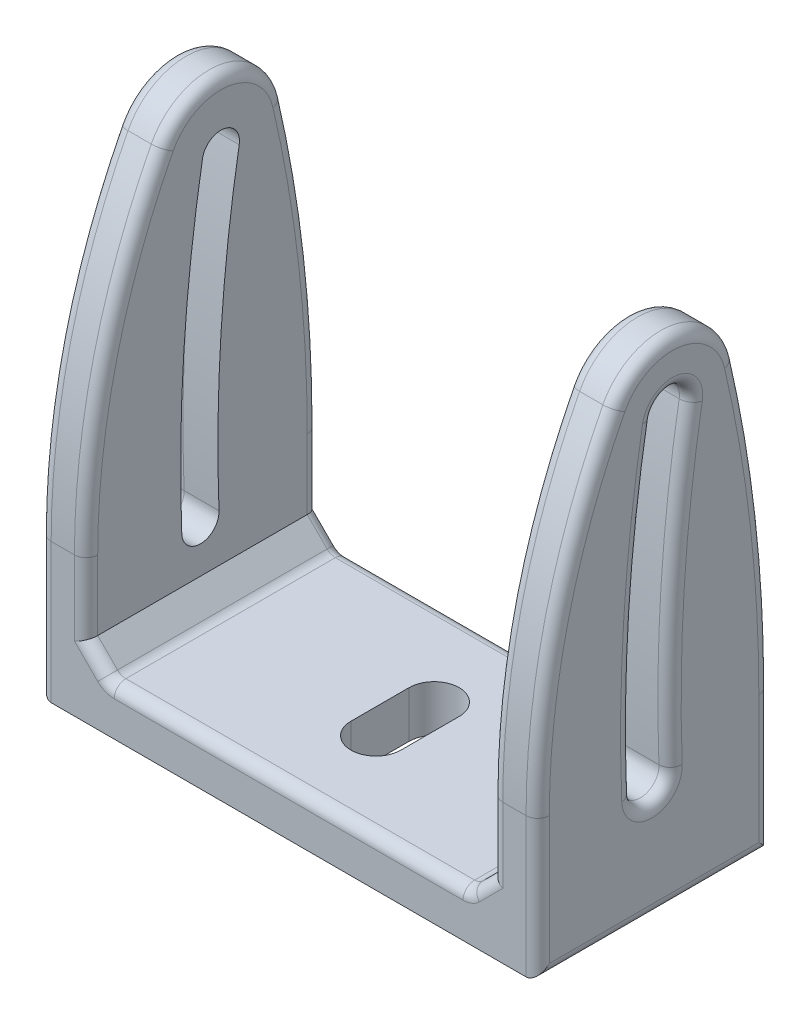
from build123d import *

# Parameters (mm, degrees)
BOSS_EXTRUDE1_DEPTH = 42.8
SKETCH2_W           = 34.8
SKETCH2_H           = 38.311897311
CUT_EXTRUDE1_DEPTH  = 60.585181768
CHAMFER1_SIZE       = 2
FILLET1_R           = 1
CUT_EXTRUDE2_DEPTH  = 59.306444702


with BuildPart() as part:
    # Sketch1 → Boss-Extrude1 (new body)
    with BuildSketch(Plane(origin=(0, 0, 0), x_dir=(0, 0, -1), z_dir=(1, 0, 0))):
        with BuildLine():
            Line((-10, -6), (10, -6))
            Line((10, -6), (10, 6))
            ThreePointArc((10, 6), (9.25619767, 19.071476996), (7.034393072, 31.974202951))
            ThreePointArc((7.034393072, 31.974202951), (2.269388413, 36.269117533), (-3.402199146, 33.271676085))
            ThreePointArc((-3.402199146, 33.271676085), (-8.327095908, 20.029213205), (-10, 6))
            Line((-10, 6), (-10, -6))
        make_face()
        with BuildLine():
            ThreePointArc((0.001705571, 30.983312005), (-1.596543983, 17.513106187), (-1.778018244, 3.949628997))
            ThreePointArc((-1.778018244, 3.949628997), (-0.116879823, 2.413198345), (1.419550828, 4.074336766))
            ThreePointArc((1.419550828, 4.074336766), (1.596543983, 17.302893813), (3.15532829, 30.440482617))
            ThreePointArc((3.15532829, 30.440482617), (1.849931624, 32.288708671), (0.001705571, 30.983312005))
        make_face(mode=Mode.SUBTRACT)
    extrude(amount=BOSS_EXTRUDE1_DEPTH)

    # Sketch2 → Cut-Extrude1 (cut, through all)
    with BuildSketch(Plane.XY.offset(10)):
        with Locations((21.4, 17.155948656)):
            Rectangle(SKETCH2_W, SKETCH2_H)
    extrude(amount=-CUT_EXTRUDE1_DEPTH, mode=Mode.SUBTRACT)

    # Chamfer1
    chamfer1_edges = [part.edges().sort_by_distance(p)[0] for p in [
        (38.8, -2, 0),
        (4, -2, 0),
    ]]
    chamfer(chamfer1_edges, length=CHAMFER1_SIZE)

    # Fillet1
    fillet1_edges = [part.edges().sort_by_distance(p)[0] for p in [
        (38.8, 3, -10),
        (38.8, 3, 10),
        (4, 3, -10),
        (4, 3, 10),
        (38.8, 36.269117533, -2.269388413),
        (4, 36.269117533, -2.269388413),
        (5, -1, -10),
        (5, -1, 10),
        (37.8, -1, -10),
        (37.8, -1, 10),
        (6, -2, 0),
        (21.4, -2, -10),
        (36.8, -2, 0),
        (21.4, -2, 10),
        (42.8, 36.269117533, -2.269388413),
        (0, 36.269117533, -2.269388413),
        (38.8, 19.071476996, -9.25619767),
        (38.8, 20.029213205, 8.327095908),
        (4, 19.071476996, -9.25619767),
        (4, 20.029213205, 8.327095908),
        (0, 17.302893813, -1.596543983),
        (0, 2.413198345, 0.116879823),
        (0, 17.513106187, 1.596543983),
        (0, 32.288708671, -1.849931624),
        (0, 20.029213205, 8.327095908),
        (0, 0, 10),
        (0, -6, 0),
        (0, 0, -10),
        (0, 19.071476996, -9.25619767),
        (42.8, 2.413198345, 0.116879823),
        (42.8, 17.302893813, -1.596543983),
        (42.8, 32.288708671, -1.849931624),
        (42.8, 17.513106187, 1.596543983),
        (42.8, 0, -10),
        (42.8, -6, 0),
        (42.8, 0, 10),
        (42.8, 20.029213205, 8.327095908),
        (42.8, 19.071476996, -9.25619767),
    ]]
    fillet(fillet1_edges, radius=FILLET1_R)

    # Sketch3 → Cut-Extrude2 (cut, through all)
    with BuildSketch(Plane(origin=(0, -2, 0), x_dir=(1, 0, 0), z_dir=(0, 1, 0))):
        with BuildLine():
            Line((19.25, -2.5), (19.25, 2.5))
            ThreePointArc((19.25, 2.5), (21.4, 4.65), (23.55, 2.5))
            Line((23.55, 2.5), (23.55, -2.5))
            ThreePointArc((23.55, -2.5), (21.4, -4.65), (19.25, -2.5))
        make_face()
    extrude(amount=-CUT_EXTRUDE2_DEPTH, mode=Mode.SUBTRACT)


solid = part.part
